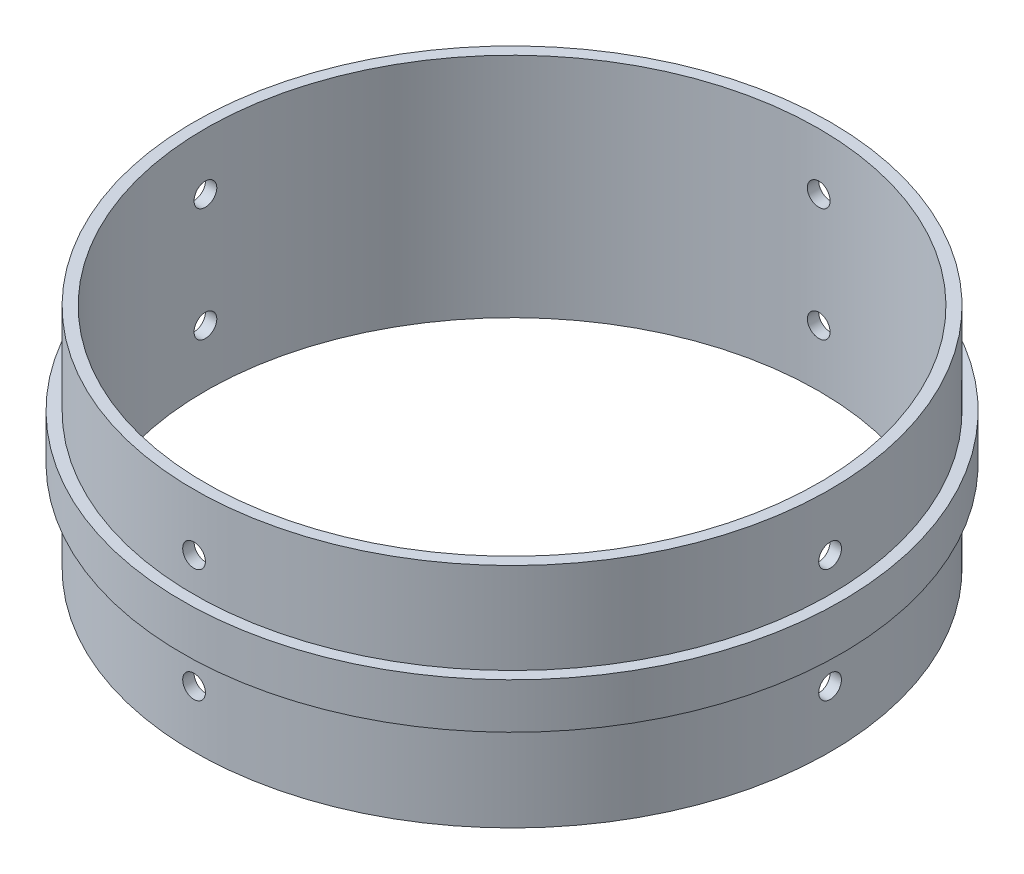
from build123d import *

# Parameters (mm, degrees)
CUT_EXTRUDE1_DEPTH      = 145.871878741
CUT_EXTRUDE1_DEPTH_BACK = 145.871878741
SKETCH2_R               = 3.175
CUT_EXTRUDE2_DEPTH      = 145.871878785
CUT_EXTRUDE2_DEPTH_BACK = 145.871878785
SKETCH3_R               = 3.175


with BuildPart() as part:
    # Sketch1 → Revolve1 (revolve)
    with BuildSketch(Plane.XY):
        Polygon((92.075, 25.4), (92.075, 38.1), (88.9, 38.1), (88.9, 63.5), (85.725, 63.5), (85.725, 0), (88.9, 0), (88.9, 25.4), align=None)
    revolve(axis=Axis((0, 0, 0), (0, 1, 0)))

    # Sketch2 → Cut-Extrude1 (cut, two sides: drawn at the far end of the back side and taken through both)
    with BuildSketch(Plane.XY.offset(-CUT_EXTRUDE1_DEPTH_BACK)):
        with Locations((0, 47.625)):
            Circle(SKETCH2_R)
        with Locations((0, 15.875)):
            Circle(SKETCH2_R)
    extrude(amount=CUT_EXTRUDE1_DEPTH + CUT_EXTRUDE1_DEPTH_BACK, mode=Mode.SUBTRACT)

    # Sketch3 → Cut-Extrude2 (cut, two sides: drawn at the far end of the back side and taken through both)
    with BuildSketch(Plane(origin=(0, 0, 0), x_dir=(0, 0, -1), z_dir=(1, 0, 0)).offset(-CUT_EXTRUDE2_DEPTH_BACK)):
        with Locations((0, 47.625)):
            Circle(SKETCH3_R)
        with Locations((0, 15.875)):
            Circle(SKETCH3_R)
    extrude(amount=CUT_EXTRUDE2_DEPTH + CUT_EXTRUDE2_DEPTH_BACK, mode=Mode.SUBTRACT)


solid = part.part
